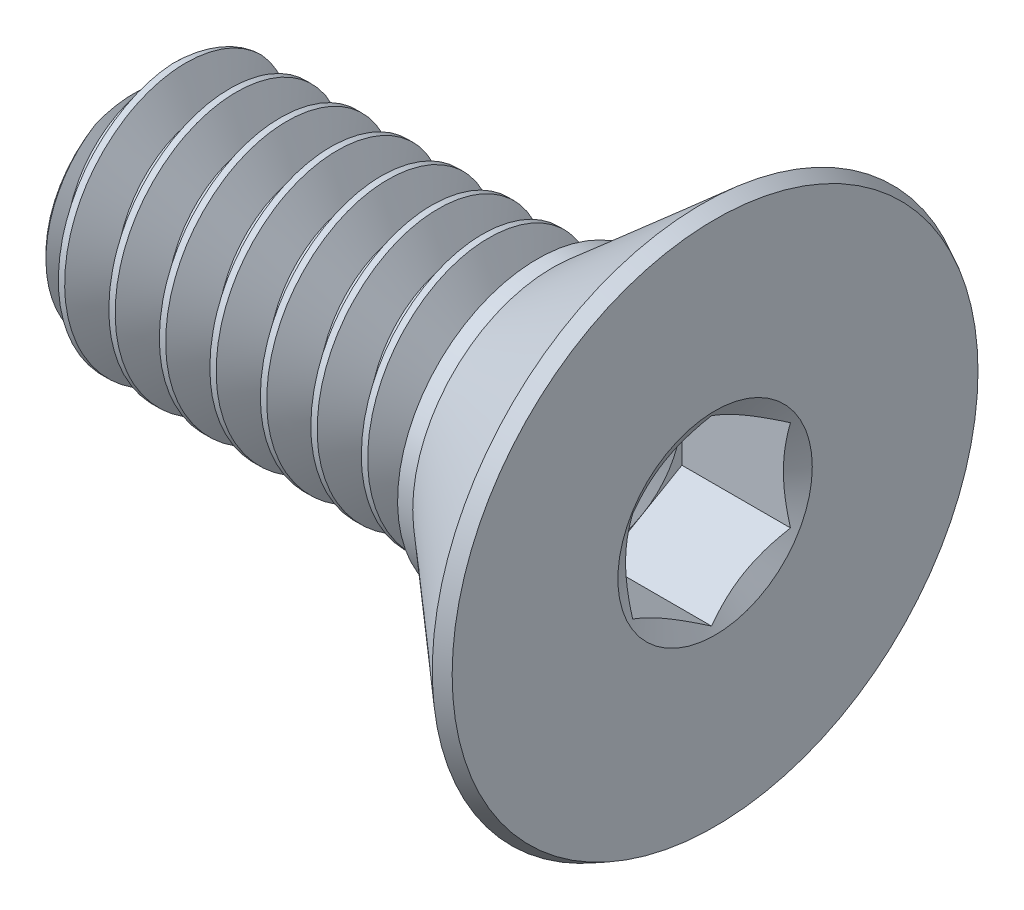
from build123d import *

# Parameters (mm, degrees)
CUT_EXTRUDE1_DEPTH  = 2.8194
CUT_SWEEP1_PITCH    = 1.27
CUT_SWEEP1_TO       = 10.1981
SKETCH11_R          = 3.514648038
BOSS_EXTRUDE1_DEPTH = 0.381


with BuildPart() as part:
    # Sketch3 → Revolve1 (revolve)
    with BuildSketch(Plane.XY, mode=Mode.PRIVATE) as revolve1_sk:
        with BuildLine():
            Line((-6.50875, 3.175), (-7.14375, 2.54))
            Line((-7.14375, 2.54), (-7.14375, 0))
            Line((-7.14375, 0), (7.14375, 0))
            Line((7.14375, 0), (7.14375, 6.612255))
            Line((7.14375, 6.612255), (6.812778399, 6.7818))
            Line((6.812778399, 6.7818), (3.05435, 3.514648038))
            Line((3.05435, 3.514648038), (3.05435, 3.313308591))
            ThreePointArc((3.05435, 3.313308591), (3.013840352, 3.215509648), (2.916041409, 3.175))
            Line((2.916041409, 3.175), (-6.50875, 3.175))
        make_face()
    revolve(revolve1_sk.sketch.rotate(Axis((7.14375, 0, 0), (-1, 0, 0)), 90), axis=Axis((7.14375, 0, 0), (-1, 0, 0)))

    # Sketch4 → Cut-Extrude1 (cut)
    with BuildSketch(Plane(origin=(7.14375, 0, 0), x_dir=(0, 0, -1), z_dir=(1, 0, 0))):
        Polygon((0, 2.291358881), (-1.984375, 1.14567944), (-1.984375, -1.14567944), (0, -2.291358881), (1.984375, -1.14567944), (1.984375, 1.14567944), align=None)
    extrude(amount=-CUT_EXTRUDE1_DEPTH, mode=Mode.SUBTRACT)

    # Cut-Extrude2 cone 1 section (through the dimple's axis) → Cut-Extrude2 (revolve, cut)
    with BuildSketch(Plane(origin=(7.14375, 0, 0), x_dir=(0, 0, -1), z_dir=(0, 1, 0))):
        Polygon((0, 0), (2.444850821, 0), (0, 1.41153528), align=None)
    revolve(axis=Axis((7.14375, 0, 0), (-1, 0, 0)), mode=Mode.SUBTRACT)

    # Cut-Extrude3 cone 1 section (through the dimple's axis) → Cut-Extrude3 (revolve, cut)
    with BuildSketch(Plane(origin=(4.32435, 0, 0), x_dir=(0, 0, -1), z_dir=(0, 1, 0))):
        Polygon((0, 0), (1.984375, 0), (0, 1.14567944), align=None)
    revolve(axis=Axis((4.32435, 0, 0), (-1, 0, 0)), mode=Mode.SUBTRACT)


with BuildPart() as body_2:
    # Split1: read off the stored shape, not the designer's step
    # Split1: the piece on the far side of the plane
    add(part.part)
    split(bisect_by=Plane.YZ.offset(3.05435), keep=Keep.BOTTOM)

    # Cut-Sweep1: arcs per turn and ends read off the stored shape
    # Cut-Sweep1: the profile of Sketch7 screwed along a right-hand helix through 11.25 turns, 8 arcs to a turn; built about Z, then put on its axis
    cut_sweep1_z = Axis((0, 0, 0), (0, 0, 1))
    cut_sweep1_corners = [(2.350110803, 0, -0.635), (3.243740766, 0, -1.1509375), (3.243740766, 0, 0.0396875), (2.350110803, 0, -0.47625)]
    with BuildLine(mode=Mode.PRIVATE) as cut_sweep1_profile:
        Line(cut_sweep1_corners[0], cut_sweep1_corners[1])
        Line(cut_sweep1_corners[1], cut_sweep1_corners[2])
        Line(cut_sweep1_corners[2], cut_sweep1_corners[3])
        Line(cut_sweep1_corners[3], cut_sweep1_corners[0])
    cut_sweep1_cap = Face(cut_sweep1_profile.wire())
    cut_sweep1_turn_angles = [0, 22.5, 45, 67.5, 90, 112.5, 135, 157.5, 180, 202.5, 225, 247.5, 270, 292.5, 315, 337.5, 360]
    cut_sweep1_turn_weights = [1, 0.9238795325112867, 1, 0.9238795325112867, 1, 0.9238795325112867, 1, 0.9238795325112867, 1, 0.9238795325112867, 1, 0.9238795325112867, 1, 0.9238795325112867, 1, 0.9238795325112867, 1]
    cut_sweep1_turn_rails = [Edge.make_bspline([Vector(p[0], p[1], 0).rotate(cut_sweep1_z, cut_sweep1_turn_angles[k]) / cut_sweep1_turn_weights[k] + Vector(0, 0, p[2] + CUT_SWEEP1_PITCH * cut_sweep1_turn_angles[k] / 360) for k in range(17)], [0, 0, 0, 1, 1, 2, 2, 3, 3, 4, 4, 5, 5, 6, 6, 7, 7, 8, 8, 8], 2, cut_sweep1_turn_weights) for p in cut_sweep1_corners]
    cut_sweep1_turn_sides = [Face.make_surface_from_curves(cut_sweep1_turn_rails[p[0]], cut_sweep1_turn_rails[p[1]]) for p in [(0, 1), (1, 2), (2, 3), (3, 0)]]
    cut_sweep1_last_angles = [3960, 3982.5, 4005, 4027.5, 4050]
    cut_sweep1_last_weights = [1, 0.9238795325112867, 1, 0.9238795325112715, 1]
    cut_sweep1_last_rails = [Edge.make_bspline([Vector(p[0], p[1], 0).rotate(cut_sweep1_z, cut_sweep1_last_angles[k]) / cut_sweep1_last_weights[k] + Vector(0, 0, p[2] + CUT_SWEEP1_PITCH * cut_sweep1_last_angles[k] / 360) for k in range(5)], [0, 0, 0, 1, 1, 2, 2, 2], 2, cut_sweep1_last_weights) for p in cut_sweep1_corners]
    cut_sweep1_last_sides = [Face.make_surface_from_curves(cut_sweep1_last_rails[p[0]], cut_sweep1_last_rails[p[1]]) for p in [(0, 1), (1, 2), (2, 3), (3, 0)]]
    cut_sweep1 = Plane(origin=(-7.14375, 0, 0), x_dir=(0, -1, 0), z_dir=(1, 0, 0)) * split(Solid(Shell([*[p.moved(Location((0, 0, CUT_SWEEP1_PITCH * i))) for i in range(11) for p in cut_sweep1_turn_sides], *cut_sweep1_last_sides, cut_sweep1_cap, cut_sweep1_cap.rotate(cut_sweep1_z, 4050).moved(Location((0, 0, CUT_SWEEP1_PITCH * 4050 / 360)))])), bisect_by=Plane.XY.offset(CUT_SWEEP1_TO), keep=Keep.BOTTOM, mode=Mode.PRIVATE)
    add(cut_sweep1, mode=Mode.SUBTRACT)


with BuildPart() as part_1:
    add(part.part)

    # Split1
    split(bisect_by=Plane.YZ.offset(3.05435), keep=Keep.TOP)

    add(body_2.part)  # Boss-Extrude1 merges body 2
    # Sketch11 → Boss-Extrude1 (add)
    with BuildSketch(Plane.ZY.offset(-3.05435)):
        with Locations(Location((0, 0, 0), (0, 0, 180))):
            Circle(SKETCH11_R)
    extrude(amount=BOSS_EXTRUDE1_DEPTH)

    # Boss-Extrude2: read off the stored shape, not the designer's step
    # Boss-Extrude2 outline → Boss-Extrude2 (revolve)
    with BuildSketch(Plane.YX):
        Polygon((2.350102345, 2.67335), (2.350102345, 1.857926328), (3.514648038, 2.67335), align=None)
    revolve(axis=Axis((0, 0, 0), (1, 0, 0)))


solid = part_1.part
